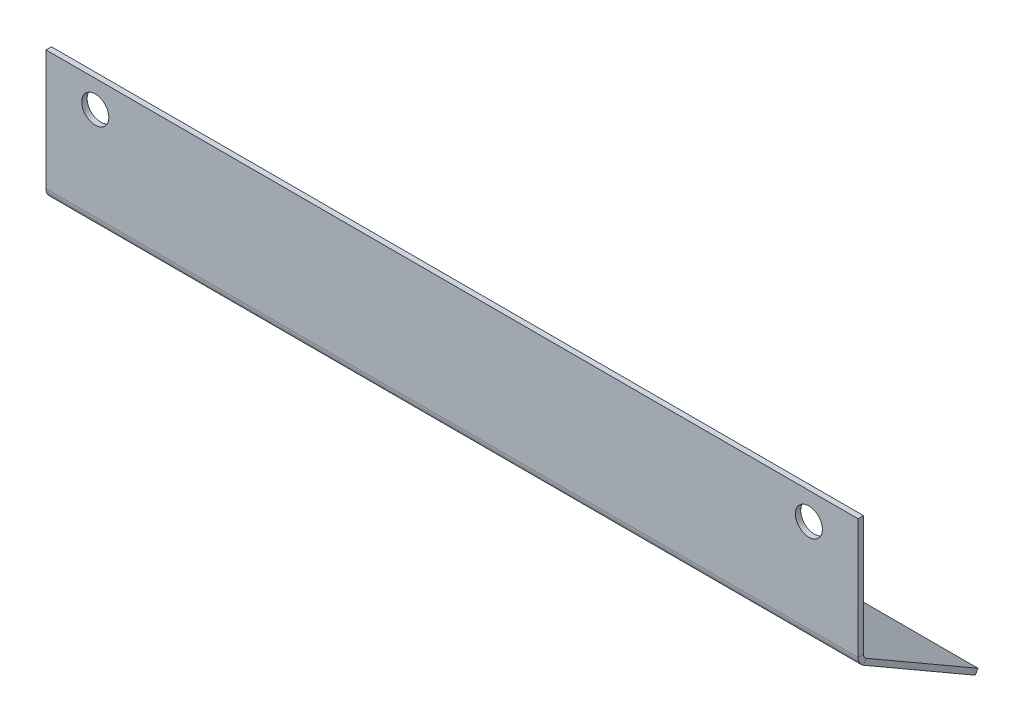
from build123d import *

# Parameters (mm, degrees)
SKETCH1_W            = 150
SKETCH1_H            = 23.35790613
BASE_FLANGE1_DEPTH   = 1
EDGE_FLANGE2_START   = -100
EDGE_FLANGE2_DEPTH   = 150
EDGE_FLANGE2_2_DEPTH = 150
SKETCH13_R           = 2.5
CUT_EXTRUDE1_DEPTH   = 3


# Read off the part's stored shape, not the designer's step: Edge-Flange2
# Sheet-metal steps are written as plain solids
with BuildPart() as part:
    # Sketch1 → Base-Flange1 (new body)
    with BuildSketch(Plane.XY):
        with Locations((-25, 17.550273337)):
            Rectangle(SKETCH1_W, SKETCH1_H)
    extrude(amount=-BASE_FLANGE1_DEPTH)

    # Edge-Flange2 outline → Edge-Flange2 (cut)
    with BuildSketch(Plane.YZ.offset(EDGE_FLANGE2_START)):
        with BuildLine():
            Line((5.871320272, 0), (5.871320272, -0.367006837))
            ThreePointArc((5.871320272, -0.367006837), (6.420209917, -0.093958772), (7.02602081, 0))
            Line((7.02602081, 0), (5.871320272, 0))
        make_face()
    extrude(amount=EDGE_FLANGE2_DEPTH, mode=Mode.SUBTRACT)

    # Edge-Flange2 2 outline → Edge-Flange2 2 (add)
    with BuildSketch(Plane.YZ.offset(EDGE_FLANGE2_START)):
        with BuildLine():
            ThreePointArc((5.871320272, -0.367006837), (5.548352573, -0.652225322), (5.293970003, -1))
            Line((5.293970003, -1), (-6.628679728, -21.650635095))
            Line((-6.628679728, -21.650635095), (-5.762654324, -22.150635095))
            Line((-5.762654324, -22.150635095), (6.159995406, -1.5))
            ThreePointArc((6.159995406, -1.5), (6.52602081, -1.133974596), (7.02602081, -1))
            Line((7.02602081, -1), (5.871320272, -1))
            Line((5.871320272, -1), (5.871320272, -0.367006837))
        make_face()
    extrude(amount=EDGE_FLANGE2_2_DEPTH)

    # Sketch13 → Cut-Extrude1 (cut)
    with BuildSketch(Plane.XY):
        with Locations((40.9, 24.229226402)):
            Circle(SKETCH13_R)
        with Locations((-90.9, 24.229226402)):
            Circle(SKETCH13_R)
    extrude(amount=-CUT_EXTRUDE1_DEPTH, mode=Mode.SUBTRACT)


solid = part.part
